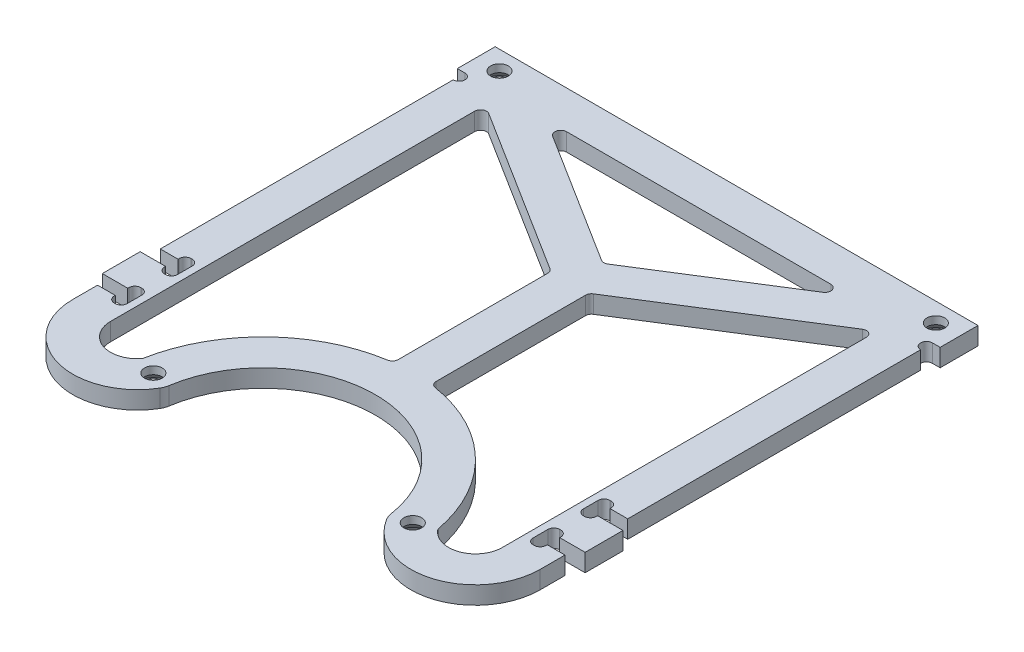
from build123d import *

# Parameters (mm, degrees)
SKETCH1_R                  = 1.5
SHAPE_DEPTH                = 3
MILL_FILLETS_R             = 1
M3_COUNTERSUNKS_AT_2_COUNT = 2
M3_COUNTERSUNKS_AT_2_PITCH = 43.84
M3_COUNTERSUNKS_AT_3_COUNT = 2
M3_COUNTERSUNKS_AT_3_PITCH = 94.086888034
M3_COUNTERSUNKS_AT_4_COUNT = 2
M3_COUNTERSUNKS_AT_4_PITCH = 74.958015582


with BuildPart() as part:
    # Sketch1 → Shape (new body)
    with BuildSketch(Plane(origin=(0, 0, 0), x_dir=(1, 0, 0), z_dir=(0, 1, 0))):
        with BuildLine():
            Line((-39.5, 31.525), (-39.5, -17.975))
            Line((-39.5, -17.975), (-36.5, -17.975))
            Line((-36.5, -17.975), (-36.5, -16.775))
            Line((-36.5, -16.775), (-34.3, -16.775))
            Line((-34.3, -16.775), (-34.3, -21.275))
            Line((-34.3, -21.275), (-36.5, -21.275))
            Line((-36.5, -21.275), (-36.5, -20.075))
            Line((-36.5, -20.075), (-40.8, -20.075))
            Line((-40.8, -20.075), (-40.8, -26.475))
            Line((-40.8, -26.475), (-36.5, -26.475))
            Line((-36.5, -26.475), (-36.5, -25.275))
            Line((-36.5, -25.275), (-34.3, -25.275))
            Line((-34.3, -25.275), (-34.3, -29.775))
            Line((-34.3, -29.775), (-36.5, -29.775))
            Line((-36.5, -29.775), (-36.5, -28.575))
            Line((-36.5, -28.575), (-39.5, -28.575))
            Line((-39.5, -28.575), (-39.5, -32.775))
            ThreePointArc((-39.5, -32.775), (-31.463250996, -43.317025147), (-19.169019254, -38.359657437))
            ThreePointArc((-19.169019254, -38.359657437), (-18.907854121, -37.80526719), (-18.757160547, -37.211257746))
            ThreePointArc((-18.757160547, -37.211257746), (1.83e-07, -21.117459559), (18.757160603, -37.211258109))
            ThreePointArc((18.757160603, -37.211258109), (18.907854183, -37.805267363), (19.169019254, -38.359657437))
            ThreePointArc((19.169019254, -38.359657437), (31.463250996, -43.317025147), (39.5, -32.775))
            Line((39.5, -32.775), (39.5, -28.575))
            Line((39.5, -28.575), (36.5, -28.575))
            Line((36.5, -28.575), (36.5, -29.775))
            Line((36.5, -29.775), (34.3, -29.775))
            Line((34.3, -29.775), (34.3, -25.275))
            Line((34.3, -25.275), (36.5, -25.275))
            Line((36.5, -25.275), (36.5, -26.475))
            Line((36.5, -26.475), (40.8, -26.475))
            Line((40.8, -26.475), (40.8, -20.075))
            Line((40.8, -20.075), (36.5, -20.075))
            Line((36.5, -20.075), (36.5, -21.275))
            Line((36.5, -21.275), (34.3, -21.275))
            Line((34.3, -21.275), (34.3, -16.775))
            Line((34.3, -16.775), (36.5, -16.775))
            Line((36.5, -16.775), (36.5, -17.975))
            Line((36.5, -17.975), (39.5, -17.975))
            Line((39.5, -17.975), (39.5, 31.525))
            ThreePointArc((39.5, 31.525), (38.5, 32.525), (39.5, 33.525))
            Line((39.5, 33.525), (40.8, 33.525))
            Line((40.8, 33.525), (40.8, 39.925))
            Line((40.8, 39.925), (-40.8, 39.925))
            Line((-40.8, 39.925), (-40.8, 33.525))
            Line((-40.8, 33.525), (-39.5, 33.525))
            ThreePointArc((-39.5, 33.525), (-38.5, 32.525), (-39.5, 31.525))
        make_face()
        with BuildLine():
            Line((-33.1, 30.566619216), (-3.2, 11.757508587))
            Line((-3.2, 11.757508587), (-3.2, -14.920021175))
            ThreePointArc((-3.2, -14.920021175), (-17.44657774, -21.665770933), (-24.962066098, -35.521728201))
            ThreePointArc((-24.962066098, -35.521728201), (-30.016975121, -37.06948728), (-33.1, -32.775))
            Line((-33.1, -32.775), (-33.1, 30.566619216))
        make_face(mode=Mode.SUBTRACT)
        with Locations((-36.88, 36.725)):
            Circle(SKETCH1_R, mode=Mode.SUBTRACT)
        Polygon((0, 17.305506597), (-25.783401581, 33.525), (25.783401581, 33.525), align=None, mode=Mode.SUBTRACT)
        with Locations((36.88, 36.725)):
            Circle(SKETCH1_R, mode=Mode.SUBTRACT)
        with BuildLine():
            Line((3.2, 11.757508587), (33.1, 30.566619216))
            Line((33.1, 30.566619216), (33.1, -32.775))
            ThreePointArc((33.1, -32.775), (30.016975121, -37.06948728), (24.962066098, -35.521728201))
            ThreePointArc((24.962066098, -35.521728201), (17.44657774, -21.665770933), (3.2, -14.920021175))
            Line((3.2, -14.920021175), (3.2, 11.757508587))
        make_face(mode=Mode.SUBTRACT)
        with Locations((-21.92, -36.725)):
            Circle(SKETCH1_R, mode=Mode.SUBTRACT)
        with Locations((21.92, -36.725)):
            Circle(SKETCH1_R, mode=Mode.SUBTRACT)
    extrude(amount=SHAPE_DEPTH)

    # Mill fillets
    mill_fillets_edges = [part.edges().sort_by_distance(p)[0] for p in [
        (36.5, 1.5, 21.275),
        (34.3, 1.5, 21.275),
        (34.3, 1.5, 16.775),
        (36.5, 1.5, 16.775),
        (36.5, 1.5, 25.275),
        (34.3, 1.5, 25.275),
        (36.5, 1.5, 29.775),
        (34.3, 1.5, 29.775),
        (-36.5, 1.5, 21.275),
        (-34.3, 1.5, 21.275),
        (-34.3, 1.5, 16.775),
        (-36.5, 1.5, 16.775),
        (-36.5, 1.5, 25.275),
        (-34.3, 1.5, 25.275),
        (-34.3, 1.5, 29.775),
        (-36.5, 1.5, 29.775),
        (3.2, 1.5, 14.920021175),
        (-3.2, 1.5, 14.920021175),
        (-33.1, 1.5, -30.566619216),
        (-3.2, 1.5, -11.757508587),
        (3.2, 1.5, -11.757508587),
        (33.1, 1.5, -30.566619216),
        (0, 1.5, -17.305506597),
        (25.783401581, 1.5, -33.525),
        (-25.783401581, 1.5, -33.525),
    ]]
    fillet(mill_fillets_edges, radius=MILL_FILLETS_R)

    # Sketch3 → M3 countersunks (revolve, cut)
    with BuildSketch(Plane(origin=(-21.92, 0, 36.725), x_dir=(0, 0, -1), z_dir=(1, 0, 0))):
        Polygon((0, 0), (0, 3), (1.5, 3), (1.5, 1.7), (3, 0.2), (3, 0), align=None)
    m3_countersunks = revolve(axis=Axis((-21.92, -6.35, 36.725), (0, 1, 0)), mode=Mode.SUBTRACT)

    # M3 countersunks at 2: M3 countersunks ×2
    with Locations(*[(i * M3_COUNTERSUNKS_AT_2_PITCH, 0, 0) for i in range(1, M3_COUNTERSUNKS_AT_2_COUNT)]):
        add(m3_countersunks, mode=Mode.SUBTRACT)

    # M3 countersunks at 3: M3 countersunks ×2
    with Locations(*[Vector(0.6249542441928148, 0, -0.7806613815639838) * (i * M3_COUNTERSUNKS_AT_3_PITCH) for i in range(1, M3_COUNTERSUNKS_AT_3_COUNT)]):
        add(m3_countersunks, mode=Mode.SUBTRACT)

    # M3 countersunks at 4: M3 countersunks ×2
    with Locations(*[Vector(-0.19957838910000314, 0, -0.9798818635959377) * (i * M3_COUNTERSUNKS_AT_4_PITCH) for i in range(1, M3_COUNTERSUNKS_AT_4_COUNT)]):
        add(m3_countersunks, mode=Mode.SUBTRACT)


solid = part.part
